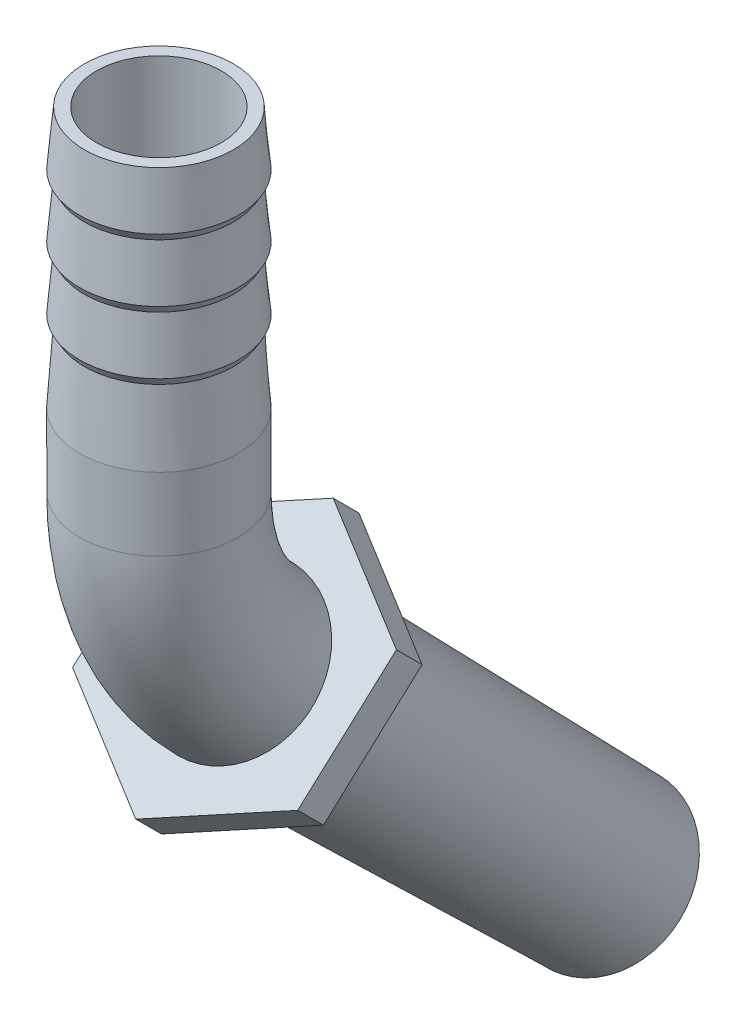
from build123d import *

# Parameters (mm, degrees)
SKETCH5_OUTSIDE_W   = 34.468
SKETCH5_OUTSIDE_H   = 34.468
CUT_EXTRUDE1_DEPTH  = 7.2
BOSS_EXTRUDE1_REACH = 51.718
SKETCH10_R          = 10.705
SKETCH10_R_2        = 6.9
BOSS_EXTRUDE3_REACH = 31.655
SKETCH12_R          = 8.3
CUT_EXTRUDE3_REACH  = 52.072
SKETCH13_R          = 4.25
CUT_EXTRUDE4_DEPTH  = 18.944444
CUT_EXTRUDE5_START  = -25.5
SKETCH19_R          = 5.15
CUT_EXTRUDE5_DEPTH  = 25.5
CUT_EXTRUDE6_START  = -43.255556
SKETCH20_R          = 28.536151212
CUT_EXTRUDE6_DEPTH  = 43.255556
SKETCH22_R          = 6.55
SKETCH22_R_2        = 5.15
SKETCH23_R          = 5.15
BOSS_EXTRUDE4_DEPTH = 3


# Read off the part's stored shape, not the designer's step: Cut-Extrude2
with BuildPart() as part:
    # Sketch1 → Revolve1 (revolve)
    with BuildSketch(Plane.XY, mode=Mode.PRIVATE) as revolve1_sk:
        Polygon((3.25, 47.7), (6.15, 47.7), (6.55, 43.217813034), (6.15, 42.533333333), (6.55, 38.051146367), (6.15, 37.366666667), (6.55, 32.8844797), (6.15, 32.2), (6.55, 26.2), (6.55, 22.2), (10.6, 22.2), (10.6, 15), (8.3, 15), (8.3, 0), (5.5, 0), (5.5, 18), (3.25, 19.7), align=None)
    revolve(revolve1_sk.sketch.rotate(Axis((0, 0, 0), (0, 1, 0)), 90), axis=Axis((0, 0, 0), (0, 1, 0)))

    # Sketch5 outside → Cut-Extrude1 (cut)
    with BuildSketch(Plane(origin=(0, 22.2, 0), x_dir=(1, 0, 0), z_dir=(0, 1, 0))):
        Rectangle(SKETCH5_OUTSIDE_W, SKETCH5_OUTSIDE_H)
        Polygon((-5.3, 9.17986928), (5.3, 9.17986928), (10.6, 0), (5.3, -9.17986928), (-5.3, -9.17986928), (-10.6, 0), align=None, mode=Mode.SUBTRACT)
    extrude(amount=-CUT_EXTRUDE1_DEPTH, mode=Mode.SUBTRACT)

    # Sketch4 → Cut-Revolve1 (revolve, cut)
    with BuildSketch(Plane.XY, mode=Mode.PRIVATE) as cut_revolve1_sk:
        Polygon((6.9, 0), (8.3, 1.4), (8.3, 0), align=None)
        Polygon((8.3, 15), (10.6, 15.837131539), (10.6, 15), align=None)
        Polygon((8.3, 22.2), (10.6, 21.362868461), (10.6, 22.2), align=None)
    revolve(cut_revolve1_sk.sketch.rotate(Axis((0, 0, 0), (0, 1, 0)), 90), axis=Axis((0, 0, 0), (0, 1, 0)), mode=Mode.SUBTRACT)

    # Boss-Extrude1: up to this cone (the profile starts outside it)
    boss_extrude1_end = Plane(origin=(0, 0, 0), z_dir=(0, 1, 0)).offset(11.979048056) * Cone(2.747e-06, 110.555614597, 40.238951944, align=(Align.CENTER, Align.CENTER, Align.MIN), mode=Mode.PRIVATE)
    # Sketch10 → Boss-Extrude1 (add, up to the surface)
    with BuildSketch(Plane.XZ, mode=Mode.PRIVATE) as boss_extrude1_sk1:
        with Locations(Location((0, 0, 0), (0, 0, 270))):
            Circle(SKETCH10_R)
        Circle(SKETCH10_R_2, mode=Mode.SUBTRACT)
    boss_extrude1_tool1 = extrude(boss_extrude1_sk1.sketch, amount=-BOSS_EXTRUDE1_REACH, mode=Mode.PRIVATE) - boss_extrude1_end
    add(boss_extrude1_tool1.solids().sort_by_distance((0, 0, 10.402217))[0])

    # Cut-Extrude2 outline → Cut-Extrude2 (revolve, cut)
    with BuildSketch(Plane.XY):
        Polygon((7.874, 16.206311111), (5.5, 18), (5.5, 0), (7.874, 0), align=None)
    revolve(axis=Axis((0, 0, 0), (0, 1, 0)), mode=Mode.SUBTRACT)

    # Boss-Extrude3: up to this cone (the profile starts inside it)
    boss_extrude3_end = Plane(origin=(0, 22.2, 0), z_dir=(0, 1, 0)).offset(-10.220951944) * Cone(2.747e-06, 193.581188051, 70.457789364, align=(Align.CENTER, Align.CENTER, Align.MIN), mode=Mode.PRIVATE)
    # Sketch12 → Boss-Extrude3 (add, up to the surface)
    with BuildSketch(Plane(origin=(0, 22.2, 0), x_dir=(1, 0, 0), z_dir=(0, 1, 0)), mode=Mode.PRIVATE) as boss_extrude3_sk1:
        Polygon((-5.415470054, 9.37986928), (-10.830940108, 0), (-5.415470054, -9.37986928), (5.415470054, -9.37986928), (10.830940108, 0), (5.415470054, 9.37986928), align=None)
        Circle(SKETCH12_R, mode=Mode.SUBTRACT)
    boss_extrude3_tool1 = extrude(boss_extrude3_sk1.sketch, amount=-BOSS_EXTRUDE3_REACH, mode=Mode.PRIVATE) & boss_extrude3_end
    add(boss_extrude3_tool1.solids().sort_by_distance((-7.875037, 22.2, -4.546655))[0])

    # Cut-Extrude3: up to this cone (the profile starts outside it)
    cut_extrude3_end = Plane(origin=(0, 47.7, 0), z_dir=(0, -1, 0)).offset(25.544445444) * Cone(1.324e-06, 35.771764706, 27.027554556, align=(Align.CENTER, Align.CENTER, Align.MIN), mode=Mode.PRIVATE)
    # Sketch13 → Cut-Extrude3 (cut, up to the surface)
    with BuildSketch(Plane(origin=(0, 47.7, 0), x_dir=(1, 0, 0), z_dir=(0, 1, 0)), mode=Mode.PRIVATE) as cut_extrude3_sk1:
        with Locations(Location((0, 0, 0), (0, 0, 270))):
            Circle(SKETCH13_R)
    cut_extrude3_tool1 = extrude(cut_extrude3_sk1.sketch, amount=-CUT_EXTRUDE3_REACH, mode=Mode.PRIVATE) - cut_extrude3_end
    add(cut_extrude3_tool1.solids().sort_by_distance((0, 47.7, 0))[0], mode=Mode.SUBTRACT)

    # Sketch15 → Cut-Extrude4 (cut)
    with BuildSketch(Plane(origin=(0, 18.944444444, 0), x_dir=(-1, 0, 0), z_dir=(0, -1, 0))):
        Polygon((11.188972746, 19.37986928), (-11.188972746, 19.37986928), (-22.377945491, 0), (-11.188972746, -19.37986928), (11.188972746, -19.37986928), (22.377945491, 0), align=None)
    extrude(amount=CUT_EXTRUDE4_DEPTH, mode=Mode.SUBTRACT)

    # Sketch18 → Revolve2 (revolve)
    with BuildSketch(Plane(origin=(0, 0, 0), x_dir=(0, 0, -1), z_dir=(1, 0, 0))):
        Polygon((4.25, 18.944444444), (3.551797403, -21.055555556), (4.551797403, -21.055555556), (5.25, 18.944444444), align=None)
    revolve(axis=Axis((0, 18.944444444, 0), (0, 1, 0)))

    # Sketch19 → Cut-Extrude5 (cut)
    with BuildSketch(Plane(origin=(0, 47.7, 0), x_dir=(1, 0, 0), z_dir=(0, 1, 0)).offset(CUT_EXTRUDE5_START)):
        with Locations(Location((0, 0, 0), (0, 0, 270))):
            Circle(SKETCH19_R)
    extrude(amount=CUT_EXTRUDE5_DEPTH, mode=Mode.SUBTRACT)

    # Sketch20 → Cut-Extrude6 (cut)
    with BuildSketch(Plane.XZ.offset(21.055555556).offset(CUT_EXTRUDE6_START)):
        Circle(SKETCH20_R)
    extrude(amount=CUT_EXTRUDE6_DEPTH, mode=Mode.SUBTRACT)

    # Sweep2: sweep along a path in Sketch21
    with BuildLine(Plane(origin=(0, 0, 0), x_dir=(0, 0, -1), z_dir=(1, 0, 0))) as sweep2_path:
        Line((0, 22.2), (0, 20.2))
        ThreePointArc((0, 20.2), (1.621535411, 12.04799099), (6.239277577, 5.137051454))
    # Sketch22 → Sweep2 (sweep)
    with BuildSketch(Plane.XZ.offset(-22.2)):
        Circle(SKETCH22_R)
        Circle(SKETCH22_R_2, mode=Mode.SUBTRACT)
    sweep(path=sweep2_path.line)

    # Sketch23 → Boss-Extrude4 (add)
    with BuildSketch(Plane(origin=(0, -0.551113062, -0.551113062), x_dir=(1, 0, 0), z_dir=(0, -0.7071067811865513, -0.7071067811865437))):
        Polygon((9.706986403, -13.21553795), (9.331934473, -2.223411857), (-0.37505193, 2.947846691), (-9.706986403, -2.873020855), (-9.331934473, -13.865146949), (0.37505193, -19.036405496), align=None)
        with Locations(Location((0, -8.044279403, 0), (0, 0, 90))):
            Circle(SKETCH23_R, mode=Mode.SUBTRACT)
    extrude(amount=BOSS_EXTRUDE4_DEPTH)

    # Sketch26 → Revolve3 (revolve)
    with BuildSketch(Plane(origin=(-3.338098244, 4.430699396, -4.430699396), x_dir=(0.8825718445701068, 0.33246574197360307, -0.3324657419736067), z_dir=(0.47017756132350597, -0.6240725361798388, 0.6240725361798455)), mode=Mode.PRIVATE) as revolve3_sk:
        Polygon((10.932239672, -3.779391566), (10.282239672, -43.779391566), (8.282239672, -43.779391566), (8.932239672, -3.779391566), align=None)
    revolve(revolve3_sk.sketch.rotate(Axis((0, -0.625868813, -12.002197844), (0, 0.7071067811865513, 0.7071067811865438)), 61.954176959), axis=Axis((0, -0.625868813, -12.002197844), (0, 0.7071067811865513, 0.7071067811865438)))


solid = part.part
